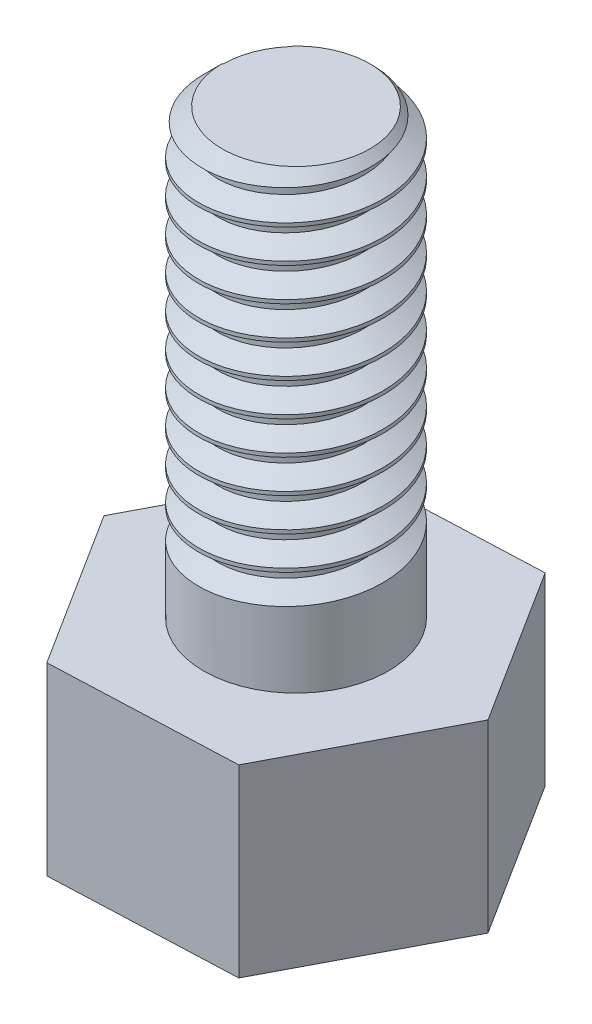
from build123d import *

# Parameters (mm, degrees)
Y_KSEKLIK_EKSTR_ZYON1_DEPTH = 5
IZIM2_R                     = 2.5
Y_KSEKLIK_EKSTR_ZYON2_DEPTH = 12
PAH1_SIZE                   = 0.5
KES_S_P_R3_PITCH            = 0.9


with BuildPart() as part:
    # Çizim1 → Yükseklik-Ekstrüzyon1 (new body)
    with BuildSketch(Plane(origin=(0, 0, 0), x_dir=(1, 0, 0), z_dir=(0, 1, 0))):
        Polygon((2.67518818, -4.22414112), (4.995807609, 0.204710364), (2.320619429, 4.428851484), (-2.67518818, 4.22414112), (-4.995807609, -0.204710364), (-2.320619429, -4.428851484), align=None)
    extrude(amount=Y_KSEKLIK_EKSTR_ZYON1_DEPTH)

    # Çizim2 → Yükseklik-Ekstrüzyon2 (add)
    with BuildSketch(Plane(origin=(0, 5, 0), x_dir=(1, 0, 0), z_dir=(0, 1, 0))):
        with Locations(Location((0, 0, 0), (0, 0, 270))):
            Circle(IZIM2_R)
    extrude(amount=Y_KSEKLIK_EKSTR_ZYON2_DEPTH)

    # Pah1
    pah1_edges = [part.edges().sort_by_distance(p)[0] for p in [
        (0, 17, -2.5),
    ]]
    chamfer(pah1_edges, length=PAH1_SIZE)

    # Kes-Süpür3: the profile of Çizim4 screwed along a right-hand helix of 11.111111 turns, 8 arcs to a turn; built about Z, then put on its axis
    kes_s_p_r3_z = Axis((0, 0, 0), (0, 0, 1))
    kes_s_p_r3_corners = [(2.5, 0.022880786, -0.399345051), (2.5, -0.022880786, 0.399345051), (1.980384758, -0.005720196, 0.099836263), (1.980384758, 0.005720196, -0.099836263)]
    with BuildLine(mode=Mode.PRIVATE) as kes_s_p_r3_profile:
        Line(kes_s_p_r3_corners[0], kes_s_p_r3_corners[1])
        Line(kes_s_p_r3_corners[1], kes_s_p_r3_corners[2])
        Line(kes_s_p_r3_corners[2], kes_s_p_r3_corners[3])
        Line(kes_s_p_r3_corners[3], kes_s_p_r3_corners[0])
    kes_s_p_r3_cap = Face(kes_s_p_r3_profile.wire())
    kes_s_p_r3_turn_angles = [0, 22.5, 45, 67.5, 90, 112.5, 135, 157.5, 180, 202.5, 225, 247.5, 270, 292.5, 315, 337.5, 360]
    kes_s_p_r3_turn_weights = [1, 0.9238795325112867, 1, 0.9238795325112867, 1, 0.9238795325112867, 1, 0.9238795325112867, 1, 0.9238795325112867, 1, 0.9238795325112867, 1, 0.9238795325112867, 1, 0.9238795325112867, 1]
    kes_s_p_r3_turn_rails = [Edge.make_bspline([Vector(p[0], p[1], 0).rotate(kes_s_p_r3_z, kes_s_p_r3_turn_angles[k]) / kes_s_p_r3_turn_weights[k] + Vector(0, 0, p[2] + KES_S_P_R3_PITCH * kes_s_p_r3_turn_angles[k] / 360) for k in range(17)], [0, 0, 0, 1, 1, 2, 2, 3, 3, 4, 4, 5, 5, 6, 6, 7, 7, 8, 8, 8], 2, kes_s_p_r3_turn_weights) for p in kes_s_p_r3_corners]
    kes_s_p_r3_turn_sides = [Face.make_surface_from_curves(kes_s_p_r3_turn_rails[p[0]], kes_s_p_r3_turn_rails[p[1]]) for p in [(0, 1), (1, 2), (2, 3), (3, 0)]]
    kes_s_p_r3_last_angles = [3960, 3980, 4000]
    kes_s_p_r3_last_weights = [1, 0.9396926207859423, 1]
    kes_s_p_r3_last_rails = [Edge.make_bspline([Vector(p[0], p[1], 0).rotate(kes_s_p_r3_z, kes_s_p_r3_last_angles[k]) / kes_s_p_r3_last_weights[k] + Vector(0, 0, p[2] + KES_S_P_R3_PITCH * kes_s_p_r3_last_angles[k] / 360) for k in range(3)], [0, 0, 0, 1, 1, 1], 2, kes_s_p_r3_last_weights) for p in kes_s_p_r3_corners]
    kes_s_p_r3_last_sides = [Face.make_surface_from_curves(kes_s_p_r3_last_rails[p[0]], kes_s_p_r3_last_rails[p[1]]) for p in [(0, 1), (1, 2), (2, 3), (3, 0)]]
    kes_s_p_r3 = Plane(origin=(0, 17, 0), x_dir=(-1, 0, 0), z_dir=(0, -1, 0)) * Solid(Shell([*[p.moved(Location((0, 0, KES_S_P_R3_PITCH * i))) for i in range(11) for p in kes_s_p_r3_turn_sides], *kes_s_p_r3_last_sides, kes_s_p_r3_cap, kes_s_p_r3_cap.rotate(kes_s_p_r3_z, 4000).moved(Location((0, 0, KES_S_P_R3_PITCH * 4000 / 360)))]))
    add(kes_s_p_r3, mode=Mode.SUBTRACT)


solid = part.part
